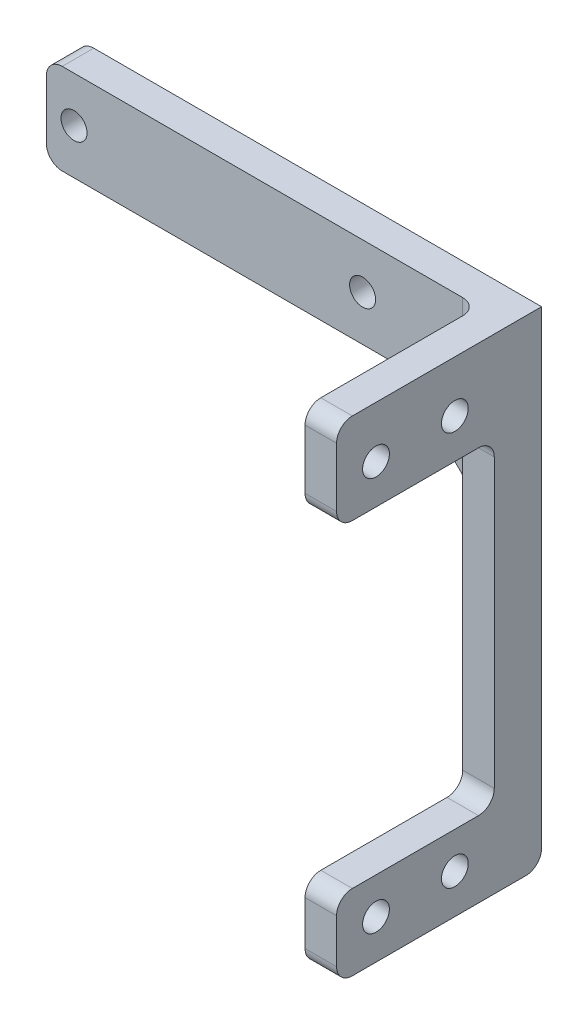
from build123d import *

# Parameters (mm, degrees)
SKETCH1_W           = 58.8
SKETCH1_H           = 4
SKETCH1_W_2         = 4
SKETCH1_H_2         = 22
BOSS_EXTRUDE1_DEPTH = 11.5
CUT_EXTRUDE1_REACH  = 67.312
SKETCH2_R           = 1.65
SKETCH3_W           = 4
SKETCH3_H           = 26
BOSS_EXTRUDE2_DEPTH = 50
CUT_EXTRUDE2_REACH  = 80.607
SKETCH4_R           = 1.7
SKETCH4_W           = 20
SKETCH4_H           = 40.4
CHAMFER1_SIZE       = 10
FILLET1_R           = 2
FILLET2_R           = 2
FILLET3_R           = 2
FILLET4_R           = 2


with BuildPart() as part:
    # Sketch1 → Boss-Extrude1 (new body)
    with BuildSketch(Plane(origin=(0, 0, 0), x_dir=(1, 0, 0), z_dir=(0, 1, 0))):
        with Locations((29.4, -2)):
            Rectangle(SKETCH1_W, SKETCH1_H)
        with Locations((56.8, -15)):
            Rectangle(SKETCH1_W_2, SKETCH1_H_2)
    extrude(amount=BOSS_EXTRUDE1_DEPTH)

    # Sketch2 → Cut-Extrude1 (cut, up to next)
    with BuildSketch(Plane(origin=(0, 0, 0), x_dir=(-1, 0, 0), z_dir=(0, 0, -1)), mode=Mode.PRIVATE) as cut_extrude1_sk1:
        with Locations((-3.5, 5.75)):
            Circle(SKETCH2_R)
    cut_extrude1_tool1 = extrude(cut_extrude1_sk1.sketch, amount=-CUT_EXTRUDE1_REACH, mode=Mode.PRIVATE) & part.part
    # Sketch2 → Cut-Extrude1 (cut, up to next)
    with BuildSketch(Plane(origin=(0, 0, 0), x_dir=(-1, 0, 0), z_dir=(0, 0, -1)), mode=Mode.PRIVATE) as cut_extrude1_sk2:
        with Locations((-40.1, 5.75)):
            Circle(SKETCH2_R)
    cut_extrude1_tool2 = extrude(cut_extrude1_sk2.sketch, amount=-CUT_EXTRUDE1_REACH, mode=Mode.PRIVATE) & part.part
    add(cut_extrude1_tool1.solids().sort_by_distance((3.5, 5.75, 0))[0], mode=Mode.SUBTRACT)
    add(cut_extrude1_tool2.solids().sort_by_distance((40.1, 5.75, 0))[0], mode=Mode.SUBTRACT)

    # Sketch3 → Boss-Extrude2 (add)
    with BuildSketch(Plane.XZ):
        with Locations((56.8, 13)):
            Rectangle(SKETCH3_W, SKETCH3_H)
    extrude(amount=BOSS_EXTRUDE2_DEPTH)

    # Sketch4 → Cut-Extrude2 (cut, up to next)
    with BuildSketch(Plane.ZY.offset(-54.8), mode=Mode.PRIVATE) as cut_extrude2_sk1:
        with Locations((11, 5)):
            Circle(SKETCH4_R)
    cut_extrude2_tool1 = extrude(cut_extrude2_sk1.sketch, amount=-CUT_EXTRUDE2_REACH, mode=Mode.PRIVATE) & part.part
    # Sketch4 → Cut-Extrude2 (cut, up to next)
    with BuildSketch(Plane.ZY.offset(-54.8), mode=Mode.PRIVATE) as cut_extrude2_sk2:
        with Locations((21, 5)):
            Circle(SKETCH4_R)
    cut_extrude2_tool2 = extrude(cut_extrude2_sk2.sketch, amount=-CUT_EXTRUDE2_REACH, mode=Mode.PRIVATE) & part.part
    # Sketch4 → Cut-Extrude2 (cut, up to next)
    with BuildSketch(Plane.ZY.offset(-54.8), mode=Mode.PRIVATE) as cut_extrude2_sk3:
        with Locations((21, -45)):
            Circle(SKETCH4_R)
    cut_extrude2_tool3 = extrude(cut_extrude2_sk3.sketch, amount=-CUT_EXTRUDE2_REACH, mode=Mode.PRIVATE) & part.part
    # Sketch4 → Cut-Extrude2 (cut, up to next)
    with BuildSketch(Plane.ZY.offset(-54.8), mode=Mode.PRIVATE) as cut_extrude2_sk4:
        with Locations((11, -45)):
            Circle(SKETCH4_R)
    cut_extrude2_tool4 = extrude(cut_extrude2_sk4.sketch, amount=-CUT_EXTRUDE2_REACH, mode=Mode.PRIVATE) & part.part
    # Sketch4 → Cut-Extrude2 (cut, up to next)
    with BuildSketch(Plane.ZY.offset(-54.8), mode=Mode.PRIVATE) as cut_extrude2_sk5:
        with Locations((16, -20.2)):
            Rectangle(SKETCH4_W, SKETCH4_H)
    cut_extrude2_tool5 = extrude(cut_extrude2_sk5.sketch, amount=-CUT_EXTRUDE2_REACH, mode=Mode.PRIVATE) & part.part
    add(cut_extrude2_tool1.solids().sort_by_distance((54.8, 5, 11))[0], mode=Mode.SUBTRACT)
    add(cut_extrude2_tool2.solids().sort_by_distance((54.8, 5, 21))[0], mode=Mode.SUBTRACT)
    add(cut_extrude2_tool3.solids().sort_by_distance((54.8, -45, 21))[0], mode=Mode.SUBTRACT)
    add(cut_extrude2_tool4.solids().sort_by_distance((54.8, -45, 11))[0], mode=Mode.SUBTRACT)
    add(cut_extrude2_tool5.solids().sort_by_distance((54.8, -20.2, 16))[0], mode=Mode.SUBTRACT)

    # Chamfer1
    chamfer1_edges = [part.edges().sort_by_distance(p)[0] for p in [
        (54.8, 0, 2),
    ]]
    chamfer(chamfer1_edges, length=CHAMFER1_SIZE)

    # Fillet1
    fillet1_edges = [part.edges().sort_by_distance(p)[0] for p in [
        (54.8, 0.75, 4),
    ]]
    fillet(fillet1_edges, radius=FILLET1_R - 0.0001)  # a hair under: the kernel refuses the full size

    # Fillet2
    fillet2_edges = [part.edges().sort_by_distance(p)[0] for p in [
        (56.8, -50, 26),
        (56.8, -40.4, 26),
        (56.8, 0, 26),
        (56.8, 11.5, 26),
        (54.8, -10, 2.99995),
        (44.8, 0, 2),
        (0, 11.5, 2),
        (0, 0, 2),
    ]]
    fillet(fillet2_edges, radius=FILLET2_R)

    # Fillet3
    fillet3_edges = [part.edges().sort_by_distance(p)[0] for p in [
        (56.8, -40.4, 6),
        (56.8, 0, 6),
    ]]
    fillet(fillet3_edges, radius=FILLET3_R)

    # Fillet4
    fillet4_edges = [part.edges().sort_by_distance(p)[0] for p in [
        (56.8, -50, 0),
    ]]
    fillet(fillet4_edges, radius=FILLET4_R)


solid = part.part
